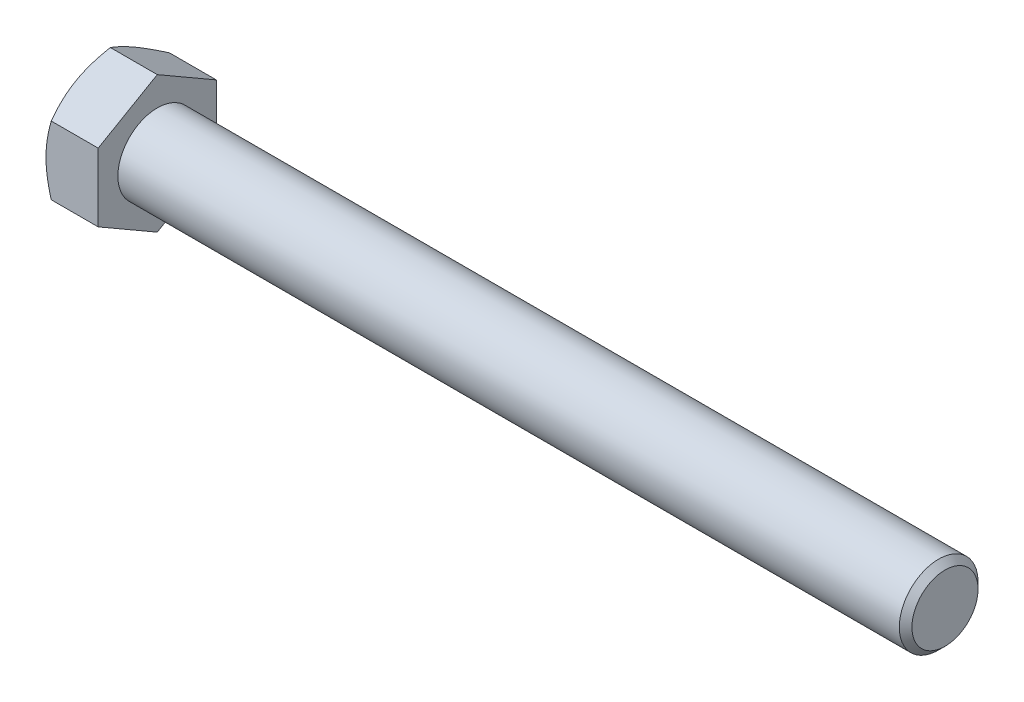
from build123d import *

# Parameters (mm, degrees)
BASEHEAD_DEPTH = 7.95


# Read off the part's stored shape, not the designer's step: HeadChamfer
with BuildPart() as part:
    # Sketch1 → BaseHead (new body)
    with BuildSketch(Plane(origin=(0, 0, 0), x_dir=(0, 0, -1), z_dir=(1, 0, 0))):
        Polygon((9, 5.196152423), (9, -5.196152423), (0, -10.392304845), (-9, -5.196152423), (-9, 5.196152423), (0, 10.392304845), align=None)
    extrude(amount=BASEHEAD_DEPTH)

    # HeadChamfer outline → HeadChamfer (revolve, cut)
    with BuildSketch(Plane.YX):
        Polygon((10.392304847, 0.803847578), (9, 0), (10.392304847, 0), align=None)
    revolve(axis=Axis((0, 0, 0), (1, 0, 0)), mode=Mode.SUBTRACT)

    # HeadChamfer 2 outline → HeadChamfer 2 (revolve)
    with BuildSketch(Plane.YX):
        Polygon((6, 7.95), (6, 126.986), (5.036, 127.95), (0, 127.95), (0, 7.95), align=None)
    revolve(axis=Axis((0, 0, 0), (1, 0, 0)))


solid = part.part
